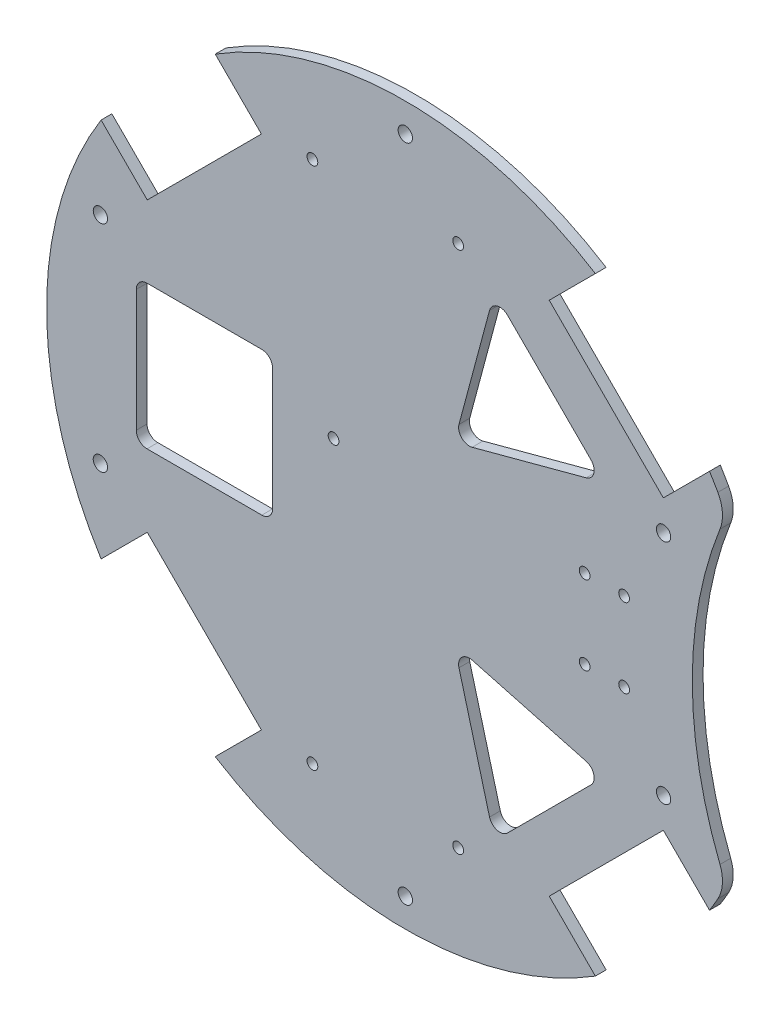
from build123d import *

# Parameters (mm, degrees)
CROQUIS1_R              = 100
SALIENTE_EXTRUIR1_DEPTH = 3
CROQUIS3_R              = 110
CORTAR_EXTRUIR1_DEPTH   = 3
REDONDEO1_R             = 10
CORTAR_EXTRUIR3_DEPTH   = 10
CROQUIS10_R             = 1.5
CORTAR_EXTRUIR4_DEPTH   = 142.453172607
CROQUIS11_R             = 2
CROQUIS11_W             = 38
CROQUIS11_H             = 40
CORTAR_EXTRUIR5_DEPTH   = 10
REDONDEO2_R             = 3
CROQUIS12_R             = 1.5
CORTAR_EXTRUIR6_DEPTH   = 142.453172607


with BuildPart() as part:
    # Croquis1 → Saliente-Extruir1 (new body)
    with BuildSketch(Plane.XY):
        Circle(CROQUIS1_R)
    extrude(amount=SALIENTE_EXTRUIR1_DEPTH)

    # Croquis3 → Cortar-Extruir1 (cut)
    with BuildSketch(Plane.XY.offset(3)):
        with Locations((190, 0)):
            Circle(CROQUIS3_R)
    extrude(amount=-CORTAR_EXTRUIR1_DEPTH, mode=Mode.SUBTRACT)

    # Redondeo1
    redondeo1_edges = [part.edges().sort_by_distance(p)[0] for p in [
        (89.473684211, -44.659375654, 1.5),
        (89.473684211, 44.659375654, 1.5),
    ]]
    fillet(redondeo1_edges, radius=REDONDEO1_R)

    # Croquis7 → Cortar-Extruir3 (cut)
    with BuildSketch(Plane.XY.offset(3)):
        Polygon((-71.939339828, -40.119534675), (-40.119534675, -71.939339828), (-57.797204204, -89.617009358), (-89.617009358, -57.797204204), align=None)
        Polygon((-40.119534675, 71.939339828), (-71.939339828, 40.119534675), (-89.617009358, 57.797204204), (-57.797204204, 89.617009358), align=None)
        Polygon((71.939339828, 40.119534675), (40.119534675, 71.939339828), (57.797204204, 89.617009358), (89.617009358, 57.797204204), align=None)
        Polygon((40.119534675, -71.939339828), (71.939339828, -40.119534675), (89.617009358, -57.797204204), (57.797204204, -89.617009358), align=None)
    extrude(amount=-CORTAR_EXTRUIR3_DEPTH, mode=Mode.SUBTRACT)

    # Croquis10 → Cortar-Extruir4 (cut, through all)
    with BuildSketch(Plane.XY.offset(3)):
        with Locations((-20, 8.5)):
            Circle(CROQUIS10_R)
        with Locations((14.74, 72.95)):
            Circle(CROQUIS10_R)
        with Locations((-25.9, 72.95)):
            Circle(CROQUIS10_R)
        with Locations((14.74, -72.95)):
            Circle(CROQUIS10_R)
        with Locations((-25.9, -72.95)):
            Circle(CROQUIS10_R)
    extrude(amount=-CORTAR_EXTRUIR4_DEPTH, mode=Mode.SUBTRACT)

    # Croquis11 → Cortar-Extruir5 (cut)
    with BuildSketch(Plane.XY.offset(3)):
        with Locations((0, 92)):
            Circle(CROQUIS11_R)
        with Locations((0, -92)):
            Circle(CROQUIS11_R)
        with Locations((72, 31.694913472)):
            Circle(CROQUIS11_R)
        with Locations((72, -31.694913472)):
            Circle(CROQUIS11_R)
        with Locations((-85, -30)):
            Circle(CROQUIS11_R)
        with Locations((-85, 30)):
            Circle(CROQUIS11_R)
        Polygon((55.443488939, 35.561561695), (24.824867154, 66.18018348), (13.617673752, 24.354368293), align=None)
        Polygon((13.617673752, -24.354368293), (55.443488939, -35.561561695), (24.824867154, -66.18018348), align=None)
        with Locations((-56, 0)):
            Rectangle(CROQUIS11_W, CROQUIS11_H)
    extrude(amount=-CORTAR_EXTRUIR5_DEPTH, mode=Mode.SUBTRACT)

    # Redondeo2
    redondeo2_edges = [part.edges().sort_by_distance(p)[0] for p in [
        (13.617673752, -24.354368293, 1.5),
        (24.824867154, -66.18018348, 1.5),
        (55.443488939, -35.561561695, 1.5),
        (55.443488939, 35.561561695, 1.5),
        (13.617673752, 24.354368293, 1.5),
        (24.824867154, 66.18018348, 1.5),
        (-75, -20, 1.5),
        (-37, -20, 1.5),
        (-75, 20, 1.5),
        (-37, 20, 1.5),
    ]]
    fillet(redondeo2_edges, radius=REDONDEO2_R)

    # Croquis12 → Cortar-Extruir6 (cut, through all)
    with BuildSketch(Plane(origin=(0, 0, 0), x_dir=(-1, 0, 0), z_dir=(0, 0, -1))):
        with Locations((-61, 11)):
            Circle(CROQUIS12_R)
        with Locations((-61, -11)):
            Circle(CROQUIS12_R)
        with Locations((-50, 11)):
            Circle(CROQUIS12_R)
        with Locations((-50, -11)):
            Circle(CROQUIS12_R)
    extrude(amount=-CORTAR_EXTRUIR6_DEPTH, mode=Mode.SUBTRACT)


solid = part.part
